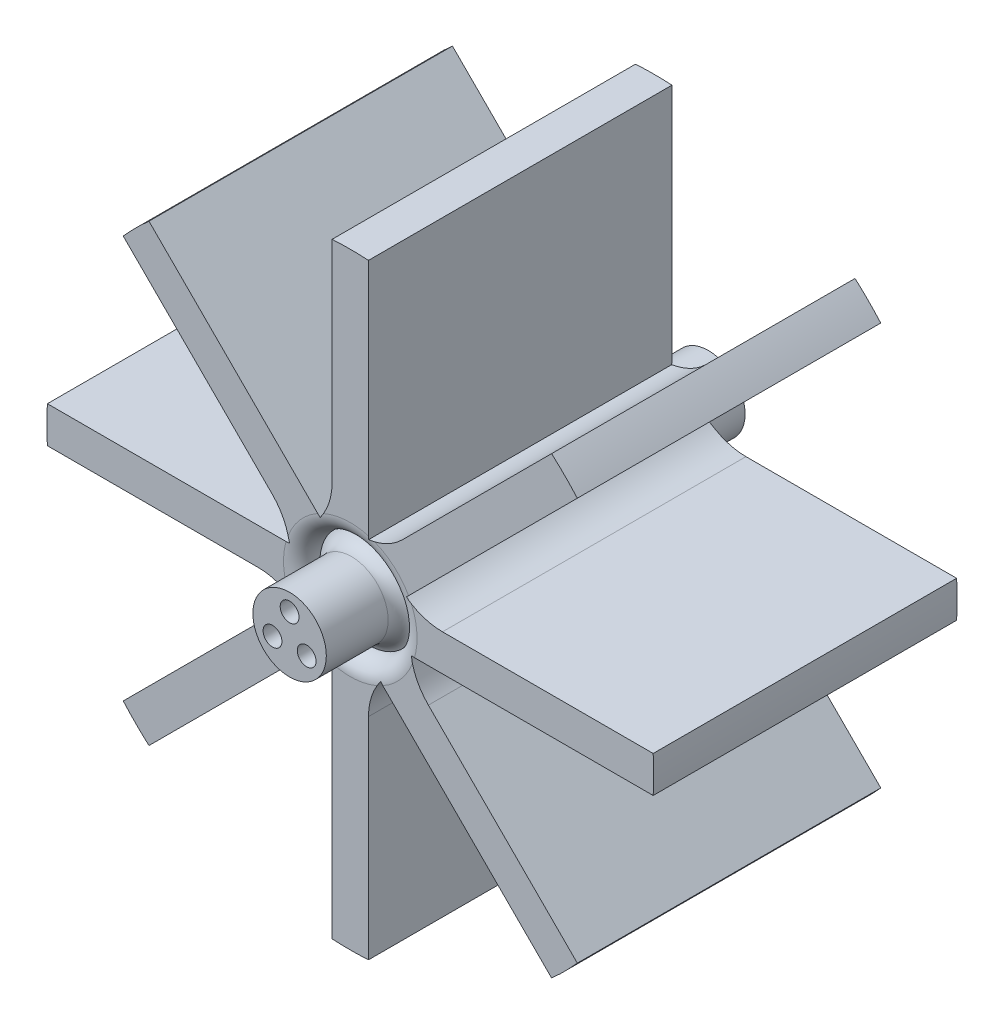
from build123d import *
from build123d.topology import SkipClean

# Parameters (mm, degrees)
BOSS_EXTRUDE1_DEPTH = 50
SKETCH2_R           = 10
BOSS_EXTRUDE3_DEPTH = 6
BOSS_EXTRUDE4_START = -50
SKETCH2_2_R         = 10
BOSS_EXTRUDE4_DEPTH = 50
SKETCH3_R           = 6.05
BOSS_EXTRUDE5_DEPTH = 9
CUT_EXTRUDE2_START  = -3
SKETCH4_R           = 8.05
SKETCH4_R_2         = 6.05
CUT_EXTRUDE2_DEPTH  = 3
FILLET1_R           = 3
FILLET2_DEPTH       = 50
CUT_EXTRUDE6_START  = -6
SKETCH8_R           = 10
CUT_EXTRUDE6_DEPTH  = 6
BOSS_EXTRUDE6_START = 10
SKETCH9_R           = 6.05
BOSS_EXTRUDE6_DEPTH = 10
SKETCH10_R          = 8
CUT_EXTRUDE7_DEPTH  = 3
FILLET3_R           = 3
SKETCH11_R          = 6.05
BOSS_EXTRUDE7_DEPTH = 23
FILLET4_R           = 3
CUT_EXTRUDE8_DEPTH  = 6
CUT_EXTRUDE9_START  = -3
CUT_EXTRUDE9_DEPTH  = 3


with BuildPart() as part:
    # Sketch1 → Boss-Extrude1 (new body)
    with BuildSketch(Plane.XY):
        with BuildLine():
            ThreePointArc((2.9999999999990807, 49.909918853871176), (-6.5197e-13, 50), (-3.0000000000003824, 49.9099188538711))
            Line((-3, 49.909918853871076), (-3, 7.242640687119284))
            Line((-3, 7.2426406871192865), (-33.17032172648287, 37.41296241360215))
            ThreePointArc((-33.170321726482385, 37.41296241360273), (-35.35533905932737, 35.35533905932738), (-37.41296241360272, 33.17032172648239))
            Line((-37.41296241360216, 33.17032172648288), (-7.242640687119308, 3.0000000000000164))
            Line((-7.242640687119305, 3.0000000000000164), (-49.90991885387109, 3))
            ThreePointArc((-49.90991885387111, 3.0000000000002145), (-50, 6.12e-15), (-49.90991885387111, -3.0000000000002016))
            Line((-49.9099188538711, -3), (-7.242640687119284, -3.0000000000000027))
            Line((-7.242640687119285, -3.0000000000000027), (-37.412962413602166, -33.17032172648288))
            ThreePointArc((-37.41296241360273, -33.170321726482385), (-35.355339059327385, -35.35533905932737), (-33.17032172648241, -37.4129624136027))
            Line((-33.17032172648289, -37.41296241360217), (-3.0000000000000053, -7.24264068711929))
            Line((-3.0000000000000053, -7.24264068711929), (-3, -49.90991885387107))
            ThreePointArc((-3.000000000000395, -49.9099188538711), (-6.7532e-13, -50), (2.9999999999990465, -49.909918853871176))
            Line((3, -49.90991885387123), (3, -7.242640687119285))
            Line((3, -7.242640687119285), (33.17032172648288, -37.412962413602166))
            ThreePointArc((33.170321726482385, -37.41296241360273), (35.35533905932737, -35.355339059327385), (37.41296241360272, -33.1703217264824))
            Line((37.412962413602166, -33.17032172648288), (7.242640687119286, -3))
            Line((7.242640687119286, -3), (49.90991885387112, -3))
            ThreePointArc((49.90991885387112, -3.000000000000043), (49.97747463954914, -1.5006760653858835), (50, -1.225e-14))
            ThreePointArc((50, 0), (49.97747463954915, 1.5006760653855677), (49.909918853871154, 2.9999999999994245))
            Line((49.90991885387119, 3), (7.242640687119281, 2.9999999999999973))
            Line((7.242640687119281, 2.9999999999999973), (37.41296241360216, 33.170321726482875))
            ThreePointArc((37.41296241360273, 33.17032172648239), (35.35533905932737, 35.35533905932738), (33.170321726482385, 37.41296241360273))
            Line((33.1703217264829, 37.41296241360218), (3.0000000000000018, 7.242640687119292))
            Line((3.0000000000000018, 7.242640687119291), (3, 49.90991885387123))
        make_face()
    extrude(amount=BOSS_EXTRUDE1_DEPTH)

    # Sketch2 → Boss-Extrude3 (add)
    with BuildSketch(Plane.XY.offset(50)):
        with Locations(Location((0, 0, 0), (0, 0, 197.457603124))):
            Circle(SKETCH2_R)
    extrude(amount=BOSS_EXTRUDE3_DEPTH)

    # Sketch2<2> → Boss-Extrude4 (add)
    with BuildSketch(Plane.XY.offset(50).offset(BOSS_EXTRUDE4_START)):
        with Locations(Location((0, 0, 0), (0, 0, 197.457603124))):
            Circle(SKETCH2_2_R)
    extrude(amount=BOSS_EXTRUDE4_DEPTH)

    # Sketch3 → Boss-Extrude5 (add)
    with BuildSketch(Plane(origin=(0, 0, 0), x_dir=(-1, 0, 0), z_dir=(0, 0, -1))):
        with Locations(Location((0, 0, 0), (0, 0, 180))):
            Circle(SKETCH3_R)
    extrude(amount=BOSS_EXTRUDE5_DEPTH)

    # Sketch4 → Cut-Extrude2 (cut)
    with BuildSketch(Plane(origin=(0, 0, 0), x_dir=(-1, 0, 0), z_dir=(0, 0, -1)).offset(CUT_EXTRUDE2_START)):
        Circle(SKETCH4_R)
        Circle(SKETCH4_R_2, mode=Mode.SUBTRACT)
    extrude(amount=CUT_EXTRUDE2_DEPTH, mode=Mode.SUBTRACT)

    # Fillet1
    # the kernel refuses this fillet: 3 mm, written as the material it adds along each edge
    with BuildSketch(Plane(origin=(0, 0, 3), x_dir=(-1, 0, 0), z_dir=(0, -1, 0))) as fillet1_piece_1:
        with BuildLine():
            CenterArc((9.05, 2.8284271247461903), FILLET1_R, 180, 70.52877936550931)
            Line((6.050000000000001, 2.8284271247461903), (6.05, 0))
            Line((6.05, 0), (8.05, 4.4e-16))
        make_face()
    revolve(axis=Axis((0, 0, 3), (0, 0, -1)))
    # the kernel refuses this fillet: 3 mm, written as the material it takes off along each edge
    with BuildSketch(Plane(origin=(0, 0, 0), x_dir=(-1, 0, 0), z_dir=(0, -1, 0))) as fillet1_2_piece_1:
        with BuildLine():
            CenterArc((8.05 + FILLET1_R, -FILLET1_R), FILLET1_R, 90, 90)
            Line((8.05, -FILLET1_R), (8.05, 0))
            Line((8.05, 0), (8.05 + FILLET1_R, 0))
        make_face()
    revolve(axis=Axis((0, 0, 0), (0, 0, -1)), mode=Mode.SUBTRACT)

    # Fillet2: read off the stored shape, not the designer's step
    # Fillet2 outline → Fillet2 (add)
    with BuildSketch(Plane.XY):
        with BuildLine():
            Line((4.624048438, 8.866689125), (8.625772287, 12.868412974))
            ThreePointArc((8.625772287, 12.868412974), (6.040879484, 11.002242186), (3, 10.044475942))
            Line((3, 10.044475942), (3, 9.539392014))
            ThreePointArc((3, 9.539392014), (3.826834324, 9.238795325), (4.624048438, 8.866689125))
        make_face()
        with BuildLine():
            Line((9.223837396, 4.981196709), (8.866689125, 4.624048438))
            ThreePointArc((8.866689125, 4.624048438), (9.238795325, 3.826834324), (9.539392014, 3))
            Line((9.539392014, 3), (15.198684154, 3))
            ThreePointArc((15.198684154, 3), (12.051306905, 3.508213211), (9.223837396, 4.981196709))
        make_face()
        with BuildLine():
            ThreePointArc((-4.624048438, 8.866689125), (-3.826834324, 9.238795325), (-3, 9.539392014))
            Line((-3, 9.539392014), (-3, 15.198684154))
            ThreePointArc((-3, 15.198684154), (-3.508213211, 12.051306905), (-4.981196709, 9.223837396))
            Line((-4.981196709, 9.223837396), (-4.624048438, 8.866689125))
        make_face()
        with BuildLine():
            ThreePointArc((-9.539392014, 3), (-9.238795325, 3.826834324), (-8.866689125, 4.624048438))
            Line((-8.866689125, 4.624048438), (-12.868412974, 8.625772287))
            ThreePointArc((-12.868412974, 8.625772287), (-11.002242186, 6.040879484), (-10.044475942, 3))
            Line((-10.044475942, 3), (-9.539392014, 3))
        make_face()
        with BuildLine():
            Line((10.044475942, -3), (9.539392014, -3))
            ThreePointArc((9.539392014, -3), (9.238795325, -3.826834324), (8.866689125, -4.624048438))
            Line((8.866689125, -4.624048438), (12.868412974, -8.625772287))
            ThreePointArc((12.868412974, -8.625772287), (11.002242186, -6.040879484), (10.044475942, -3))
        make_face()
        with BuildLine():
            ThreePointArc((-8.866689125, -4.624048438), (-9.238795325, -3.826834324), (-9.539392014, -3))
            Line((-9.539392014, -3), (-15.198684154, -3))
            ThreePointArc((-15.198684154, -3), (-12.051306905, -3.508213211), (-9.223837396, -4.981196709))
            Line((-9.223837396, -4.981196709), (-8.866689125, -4.624048438))
        make_face()
        with BuildLine():
            Line((4.981196709, -9.223837396), (4.624048438, -8.866689125))
            ThreePointArc((4.624048438, -8.866689125), (3.826834324, -9.238795325), (3, -9.539392014))
            Line((3, -9.539392014), (3, -15.198684154))
            ThreePointArc((3, -15.198684154), (3.508213211, -12.051306905), (4.981196709, -9.223837396))
        make_face()
        with BuildLine():
            ThreePointArc((-3, -9.539392014), (-3.826834324, -9.238795325), (-4.624048438, -8.866689125))
            Line((-4.624048438, -8.866689125), (-8.625772287, -12.868412974))
            ThreePointArc((-8.625772287, -12.868412974), (-6.040879484, -11.002242186), (-3, -10.044475942))
            Line((-3, -10.044475942), (-3, -9.539392014))
        make_face()
    extrude(amount=FILLET2_DEPTH)

    # Fillet2 2 outline → Fillet2 2 (revolve, cut)
    with SkipClean():  # the faces are left unmerged after this step: merging them gives an invalid solid
        with BuildSketch(Plane.XZ):
            with BuildLine():
                ThreePointArc((11.05, 0), (10.516496156, 0.047818832), (10, 0.1897509))
                Line((10, 0.1897509), (10, 0))
                Line((10, 0), (11.05, 0))
            make_face()
        revolve(axis=Axis((0, 0, 0), (0, 0, 1)), mode=Mode.SUBTRACT)

    # Sketch8 → Cut-Extrude6 (cut)
    with SkipClean():  # the faces are left unmerged after this step: merging them gives an invalid solid
        with BuildSketch(Plane.XY.offset(56).offset(CUT_EXTRUDE6_START)):
            Circle(SKETCH8_R)
        extrude(amount=CUT_EXTRUDE6_DEPTH, mode=Mode.SUBTRACT)

    # Sketch9 → Boss-Extrude6 (add)
    with SkipClean():  # the faces are left unmerged after this step: merging them gives an invalid solid
        with BuildSketch(Plane.XY.offset(50).offset(BOSS_EXTRUDE6_START)):
            Circle(SKETCH9_R)
        extrude(amount=-BOSS_EXTRUDE6_DEPTH)

    # Sketch10 → Cut-Extrude7 (cut)
    with SkipClean():  # the faces are left unmerged after this step: merging them gives an invalid solid
        with BuildSketch(Plane.XY.offset(50)):
            Circle(SKETCH10_R)
        extrude(amount=-CUT_EXTRUDE7_DEPTH, mode=Mode.SUBTRACT)


with BuildPart() as cut_extrude7_piece_1:
    # of the separate pieces the step leaves, piece 1, a body of its own (cut_extrude7_pieces)
    add(part.part.solids().sort_by_distance((-6.05, 0, 0.171572875))[0])

    # Fillet3
    # the kernel refuses this fillet: 3 mm, written as the material it takes off along each edge
    with BuildSketch(Plane(origin=(0, 0, 50), x_dir=(1, 0, 0), z_dir=(0, -1, 0))) as fillet3_piece_1:
        with BuildLine():
            CenterArc((8 + FILLET3_R, -FILLET3_R), FILLET3_R, 90, 90)
            Line((8, -FILLET3_R), (8, 0))
            Line((8, 0), (8 + FILLET3_R, 0))
        make_face()
    revolve(axis=Axis((0, 0, 50), (0, 0, 1)), mode=Mode.SUBTRACT)



with BuildPart() as cut_extrude7_piece_2:
    # of the separate pieces the step leaves, piece 2, a body of its own (cut_extrude7_pieces)
    add(part.part.solids().sort_by_distance((6.05, 0, 60))[0])


with BuildPart() as cut_extrude7_piece_1_1:
    add(cut_extrude7_piece_1.part)

    add(cut_extrude7_piece_2.part)  # Boss-Extrude7 merges Cut-Extrude7 piece 2
    # Sketch11 → Boss-Extrude7 (add)
    with BuildSketch(Plane.XY.offset(60.00000000000001)):
        Circle(SKETCH11_R)
    extrude(amount=-BOSS_EXTRUDE7_DEPTH)

    # Fillet4
    # the kernel refuses this fillet: 3 mm, written as the material it adds along each edge
    with BuildSketch(Plane(origin=(0, 0, 47), x_dir=(1, 0, 0), z_dir=(0, -1, 0))) as fillet4_piece_1:
        with BuildLine():
            CenterArc((9.05, 2.8102490992792752), FILLET4_R, 180, 69.51268488527728)
            Line((7.999999999999998, 0), (7.978999999999998, -0.05620498198558721))
            ThreePointArc((7.978999999999998, -0.05620498198558721), (7.024999999999999, -0.06000000000000227), (6.05, -0.06000000000000227))
            Line((6.05, -0.06000000000000227), (5.99, 0))
            Line((5.99, 0), (5.990000000000001, 2.8102490992792752))
            Line((5.990000000000001, 2.8102490992792752), (6.050000000000001, 2.8102490992792752))
        make_face()
    revolve(axis=Axis((0, 0, 47), (0, 0, 1)))

    # Sketch12 → Cut-Extrude8 (cut)
    with BuildSketch(Plane.XY.offset(60.00000000000001)):
        with BuildLine():
            Line((-0.7750000000000001, 1.9081426396717127), (0, 3.2504820155375924))
            Line((0, 3.2504820155375924), (0.7750000000000004, 1.9081426396717123))
            ThreePointArc((0.7750000000000109, 1.9081426396717187), (1.342339375865883, 2.4754820155375974), (1.55, 3.250482015537592))
            ThreePointArc((1.55, 3.2504820155375924), (-0.7749999999999944, 4.592821391403476), (-0.7750000000000113, 1.9081426396717192))
        make_face()
        with BuildLine():
            Line((0.7750000000000004, 1.9081426396717123), (0, 3.2504820155375924))
            Line((0, 3.2504820155375924), (0, 1.7004820155375924))
            ThreePointArc((1.09e-15, 1.7004820155375924), (0.4011695199089145, 1.7532969847895385), (0.7750000000000109, 1.9081426396717187))
        make_face()
        with BuildLine():
            Line((0, 1.7004820155375924), (0, 3.2504820155375924))
            Line((0, 3.2504820155375924), (-0.7750000000000001, 1.9081426396717127))
            ThreePointArc((-0.7750000000000113, 1.9081426396717192), (-0.4011695199089123, 1.7532969847895379), (1.09e-15, 1.7004820155375924))
        make_face()
        with BuildLine():
            Line((-2.815, -1.6252410077687962), (-2.0399999999999996, -0.2829016319029156))
            ThreePointArc((-2.0399999999999885, -0.2829016319029227), (-4.157339375865883, -2.4002410077687912), (-1.265, -1.6252410077687953))
            Line((-1.2650000000000001, -1.6252410077687962), (-2.815, -1.6252410077687962))
        make_face()
        with BuildLine():
            ThreePointArc((-1.4726606241341267, -0.8502410077687849), (-1.7189844891608514, -0.5292254969296475), (-2.0399999999999885, -0.2829016319029227))
            Line((-2.0399999999999996, -0.2829016319029156), (-2.815, -1.6252410077687962))
            Line((-2.815, -1.6252410077687962), (-1.47266062413412, -0.8502410077687963))
        make_face()
        with BuildLine():
            Line((-1.47266062413412, -0.8502410077687963), (-2.815, -1.6252410077687962))
            Line((-2.815, -1.6252410077687962), (-1.2650000000000001, -1.6252410077687962))
            ThreePointArc((-1.265, -1.6252410077687962), (-1.3178149692519456, -1.2240714878598826), (-1.4726606241341267, -0.8502410077687849))
        make_face()
        with BuildLine():
            ThreePointArc((4.365, -1.6252410077687962), (3.5899999999999945, -0.28290163190291273), (2.0399999999999885, -0.28290163190292295))
            Line((2.04, -0.2829016319029165), (2.815, -1.6252410077687962))
            Line((2.815, -1.6252410077687962), (1.2649999999999997, -1.6252410077687962))
            ThreePointArc((1.2649999999999997, -1.625241007768796), (2.8149999999999995, -3.1752410077687965), (4.365, -1.6252410077687967))
        make_face()
        with BuildLine():
            Line((2.815, -1.6252410077687962), (2.04, -0.2829016319029165))
            ThreePointArc((2.0399999999999885, -0.28290163190292295), (1.7189844891608512, -0.5292254969296473), (1.4726606241341267, -0.8502410077687842))
            Line((1.4726606241341198, -0.8502410077687962), (2.815, -1.6252410077687962))
        make_face()
        with BuildLine():
            Line((1.2649999999999997, -1.6252410077687962), (2.815, -1.6252410077687962))
            Line((2.815, -1.6252410077687962), (1.4726606241341198, -0.8502410077687962))
            ThreePointArc((1.4726606241341267, -0.8502410077687842), (1.3178149692519456, -1.2240714878598826), (1.2649999999999997, -1.625241007768796))
        make_face()
    extrude(amount=-CUT_EXTRUDE8_DEPTH, mode=Mode.SUBTRACT)

    # Sketch12<3> → Cut-Extrude9 (cut)
    with BuildSketch(Plane.XY.offset(60.00000000000001).offset(CUT_EXTRUDE9_START)):
        with BuildLine():
            Line((1.4726606241341198, -0.8502410077687962), (0.962754687166605, -0.5558466777992132))
            Line((0.9627546871666026, -0.5558466777992174), (0.9627546871666027, -1.6252410077687962))
            Line((0.9627546871666026, -1.6252410077687962), (1.2649999999999997, -1.6252410077687962))
            ThreePointArc((1.2649999999999997, -1.625241007768796), (1.3178149692519456, -1.2240714878598826), (1.4726606241341267, -0.8502410077687842))
        make_face()
        with BuildLine():
            Line((2.04, -0.2829016319029165), (1.8888773435833035, -0.02114951281442323))
            Line((1.8888773435833035, -0.02114951281442246), (0.9627546871666026, -0.5558466777992174))
            Line((0.962754687166605, -0.5558466777992132), (1.4726606241341198, -0.8502410077687962))
            ThreePointArc((1.4726606241341267, -0.8502410077687842), (1.7189844891608512, -0.5292254969296473), (2.0399999999999885, -0.28290163190292295))
        make_face()
        with BuildLine():
            Line((2.815, 0.51354765217037), (1.8888773435833035, -0.02114951281442246))
            Line((1.8888773435833035, -0.02114951281442323), (2.04, -0.2829016319029165))
            ThreePointArc((2.0399999999999885, -0.28290163190292295), (3.5899999999999945, -0.28290163190291273), (4.365, -1.6252410077687962))
            ThreePointArc((4.365, -1.6252410077687967), (2.8149999999999995, -3.1752410077687965), (1.2649999999999997, -1.625241007768796))
            Line((1.2649999999999997, -1.6252410077687962), (0.9627546871666026, -1.6252410077687962))
            Line((0.9627546871666027, -1.6252410077687962), (0.962754687166603, -2.694635337738379))
            Line((0.962754687166603, -2.694635337738379), (2.8149999999999973, -3.7640296677079643))
            Line((2.8149999999999973, -3.7640296677079643), (4.667245312833395, -2.6946353377383816))
            Line((4.667245312833395, -2.6946353377383816), (4.667245312833397, -0.5558466777992148))
            Line((4.667245312833397, -0.5558466777992148), (2.815, 0.5135476521703701))
        make_face()
        with BuildLine():
            Line((-2.0399999999999996, -0.2829016319029156), (-1.8887931260915947, -0.02100364383989728))
            Line((-1.8887931260915947, -0.02100364383989728), (-2.84384165312799, 0.5133531778889796))
            Line((-2.84384165312799, 0.5133531778889795), (-4.681497719729323, -0.5809215192358916))
            Line((-4.681497719729323, -0.5809215192358915), (-4.652656066601329, -2.7195157048936642))
            Line((-4.652656066601329, -2.7195157048936642), (-2.7861583468720013, -3.763835193426573))
            Line((-2.7861583468720013, -3.763835193426573), (-0.948502280270672, -2.6695604963017034))
            Line((-0.948502280270672, -2.6695604963017034), (-0.9625862521831863, -1.6252410077687962))
            Line((-0.9625862521831863, -1.6252410077687962), (-1.2650000000000001, -1.6252410077687962))
            ThreePointArc((-1.265, -1.6252410077687953), (-4.157339375865883, -2.4002410077687912), (-2.0399999999999885, -0.2829016319029227))
        make_face()
        with BuildLine():
            Line((-0.9773439333986662, -0.5309663106439303), (-1.8887931260915947, -0.02100364383989728))
            Line((-1.8887931260915947, -0.02100364383989728), (-2.0399999999999996, -0.2829016319029156))
            ThreePointArc((-2.0399999999999885, -0.2829016319029227), (-1.7189844891608514, -0.5292254969296475), (-1.4726606241341267, -0.8502410077687849))
            Line((-1.47266062413412, -0.8502410077687963), (-0.9768982639792171, -0.5640124756792789))
            Line((-0.9768982639792168, -0.5640124756792795), (-0.9773439333986662, -0.5309663106439304))
        make_face()
        with BuildLine():
            Line((-0.9625862521831863, -1.6252410077687962), (-0.9768982639792168, -0.5640124756792795))
            Line((-0.9768982639792171, -0.5640124756792789), (-1.47266062413412, -0.8502410077687963))
            ThreePointArc((-1.4726606241341267, -0.8502410077687849), (-1.3178149692519456, -1.2240714878598826), (-1.265, -1.6252410077687962))
            Line((-1.2650000000000001, -1.6252410077687962), (-0.9625862521831863, -1.6252410077687962))
        make_face()
        with BuildLine():
            Line((-0.9261226564166762, 1.646390520583255), (-0.7750000000000001, 1.9081426396717127))
            ThreePointArc((-0.7750000000000113, 1.9081426396717192), (-0.7749999999999944, 4.592821391403476), (1.55, 3.2504820155375924))
            ThreePointArc((1.55, 3.250482015537592), (1.342339375865883, 2.4754820155375974), (0.7750000000000109, 1.9081426396717187))
            Line((0.7750000000000004, 1.9081426396717123), (0.9261226564167034, 1.646390520583208))
            Line((0.9261226564167032, 1.646390520583208), (1.8522453128334422, 2.1810876855680315))
            Line((1.8522453128334422, 2.1810876855680315), (1.8522453128334282, 4.319876345507198))
            Line((1.8522453128334282, 4.319876345507198), (2.42e-14, 5.3892706754767685))
            Line((2.429e-14, 5.3892706754767685), (-1.8522453128333423, 4.31987634550714))
            Line((-1.8522453128333423, 4.31987634550714), (-1.8522453128333352, 2.181087685568033))
            Line((-1.8522453128333352, 2.181087685568033), (-0.9261226564166765, 1.646390520583255))
        make_face()
        with BuildLine():
            ThreePointArc((1.09e-15, 1.7004820155375924), (-0.4011695199089123, 1.7532969847895379), (-0.7750000000000113, 1.9081426396717192))
            Line((-0.7750000000000001, 1.9081426396717127), (-0.9261226564166762, 1.646390520583255))
            Line((-0.9261226564166765, 1.646390520583255), (5.396e-14, 1.1116933555984359))
            Line((0, 1.1116933555984359), (0, 1.7004820155375924))
        make_face()
        with BuildLine():
            Line((0.9261226564167034, 1.646390520583208), (0.7750000000000004, 1.9081426396717123))
            ThreePointArc((0.7750000000000109, 1.9081426396717187), (0.4011695199089145, 1.7532969847895385), (1.09e-15, 1.7004820155375924))
            Line((0, 1.7004820155375924), (0, 1.1116933555984359))
            Line((5.399e-14, 1.1116933555984359), (0.9261226564167032, 1.646390520583208))
        make_face()
    extrude(amount=-CUT_EXTRUDE9_DEPTH, mode=Mode.SUBTRACT)


solid = cut_extrude7_piece_1_1.part
